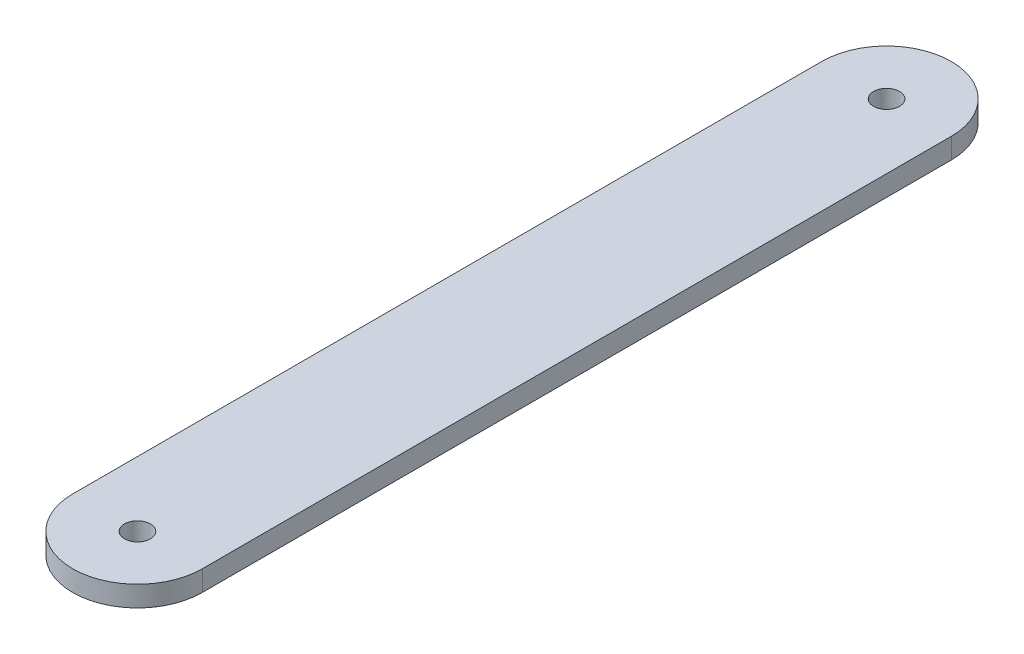
from build123d import *

# Parameters (mm, degrees)
SKETCH2_R           = 1
BOSS_EXTRUDE1_DEPTH = 1.5875


with BuildPart() as part:
    # Sketch2 → Boss-Extrude1 (new body)
    with BuildSketch(Plane(origin=(0, 0, 0), x_dir=(1, 0, 0), z_dir=(0, 1, 0))):
        with BuildLine():
            Line((-5, 57.8), (-5, 0))
            ThreePointArc((-5, 0), (0, -5), (5, 0))
            Line((5, 0), (5, 57.8))
            ThreePointArc((5, 57.8), (0, 62.8), (-5, 57.8))
        make_face()
        Circle(SKETCH2_R, mode=Mode.SUBTRACT)
        with Locations((0, 57.8)):
            Circle(SKETCH2_R, mode=Mode.SUBTRACT)
    extrude(amount=BOSS_EXTRUDE1_DEPTH)


solid = part.part
